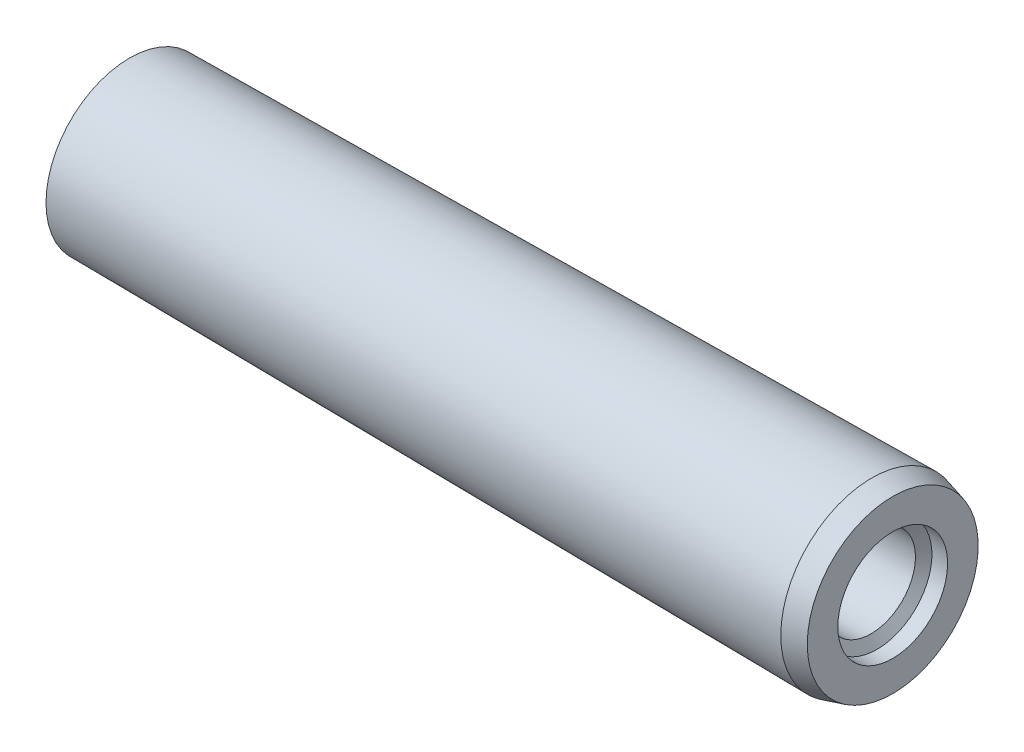
from build123d import *


with BuildPart() as part:
    # BodySke → Body (revolve)
    with BuildSketch(Plane.XY):
        with BuildLine():
            Line((2, 8), (73, 8.709999999))
            Line((73, 8.709999999), (75, 8.174101614))
            Line((75, 8.174101614), (75, 5.25))
            Line((75, 5.25), (73.5, 5.25))
            Line((73.5, 5.25), (72.922649731, 4.25))
            Line((72.922649731, 4.25), (50, 4.25))
            Line((50, 4.25), (48.23959236, 0))
            Line((48.23959236, 0), (0, 0))
            ThreePointArc((0, 0), (0.507577498, 4.123105626), (2, 8))
        make_face()
    revolve(axis=Axis((0, 0, 0), (1, 0, 0)))


solid = part.part
